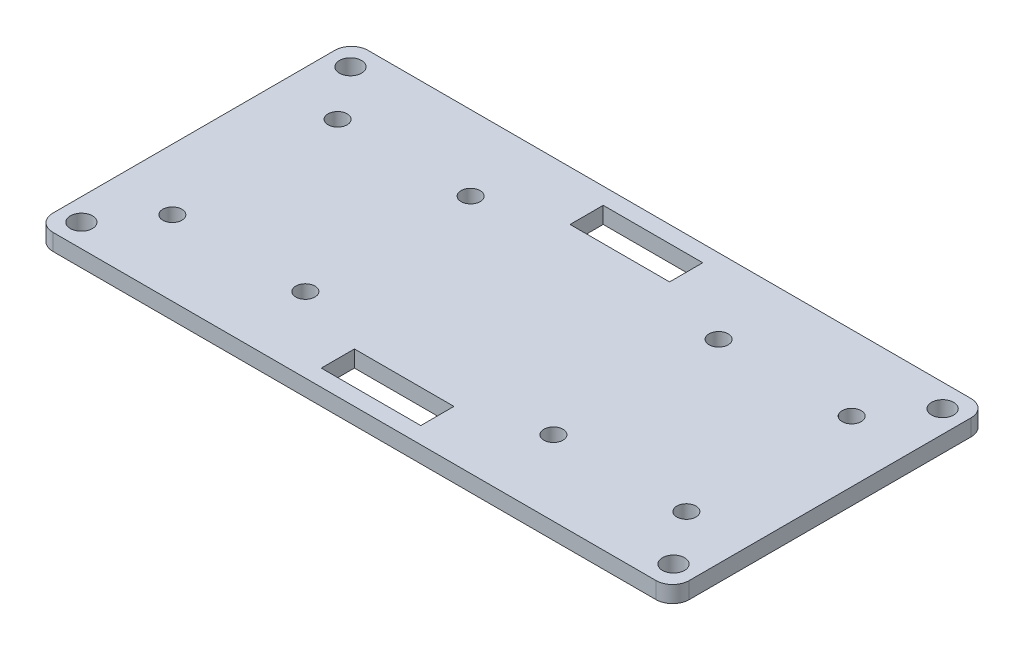
from build123d import *

# Parameters (mm, degrees)
ESBO_O1_W                = 115.09677689
ESBO_O1_H                = 57
RESSALTO_EXTRUS_O1_DEPTH = 3
ESBO_O2_R                = 1.73
CORTE_EXTRUS_O1_DEPTH    = 65.738450805
ESBO_O3_W                = 18
ESBO_O3_H                = 6
CORTE_EXTRUS_O2_DEPTH    = 65.738450805
ESBO_O5_R                = 2
CORTE_EXTRUS_O3_DEPTH    = 65.738450805
FILETE1_R                = 3


with BuildPart() as part:
    # Esboço1 → Ressalto-extrusão1 (new body)
    with BuildSketch(Plane(origin=(0, 0, 0), x_dir=(1, 0, 0), z_dir=(0, 1, 0))):
        with Locations((0, 1)):
            Rectangle(ESBO_O1_W, ESBO_O1_H)
    extrude(amount=RESSALTO_EXTRUS_O1_DEPTH)

    # Esboço2 → Corte-extrusão1 (cut, through all)
    with BuildSketch(Plane(origin=(0, 3, 0), x_dir=(1, 0, 0), z_dir=(0, 1, 0))):
        with Locations((-46.488388445, 15.945)):
            Circle(ESBO_O2_R)
        with Locations((-22.428388445, 15.945)):
            Circle(ESBO_O2_R)
        with Locations((-22.428388445, -13.945)):
            Circle(ESBO_O2_R)
        with Locations((22.428388445, -13.945)):
            Circle(ESBO_O2_R)
        with Locations((22.428388445, 15.945)):
            Circle(ESBO_O2_R)
        with Locations((46.488388445, 15.945)):
            Circle(ESBO_O2_R)
        with Locations((-46.488388445, -13.945)):
            Circle(ESBO_O2_R)
        with Locations((46.488388445, -13.945)):
            Circle(ESBO_O2_R)
    extrude(amount=-CORTE_EXTRUS_O1_DEPTH, mode=Mode.SUBTRACT)

    # Esboço3 → Corte-extrusão2 (cut, through all)
    with BuildSketch(Plane.XZ):
        with Locations((0, 21.5)):
            Rectangle(ESBO_O3_W, ESBO_O3_H)
        with Locations((0, -23.5)):
            Rectangle(ESBO_O3_W, ESBO_O3_H)
    extrude(amount=-CORTE_EXTRUS_O2_DEPTH, mode=Mode.SUBTRACT)

    # Esboço5 → Corte-extrusão3 (cut, through all)
    with BuildSketch(Plane(origin=(0, 3, 0), x_dir=(1, 0, 0), z_dir=(0, 1, 0))):
        with Locations((53.548388445, 25.3375)):
            Circle(ESBO_O5_R)
        with Locations((53.548388445, -23.3375)):
            Circle(ESBO_O5_R)
        with Locations((-53.548388445, -23.3375)):
            Circle(ESBO_O5_R)
        with Locations((-53.548388445, 25.3375)):
            Circle(ESBO_O5_R)
    extrude(amount=-CORTE_EXTRUS_O3_DEPTH, mode=Mode.SUBTRACT)

    # Filete1
    filete1_edges = [part.edges().sort_by_distance(p)[0] for p in [
        (57.548388445, 1.5, -29.5),
        (57.548388445, 1.5, 27.5),
        (-57.548388445, 1.5, 27.5),
        (-57.548388445, 1.5, -29.5),
    ]]
    fillet(filete1_edges, radius=FILETE1_R)


solid = part.part
